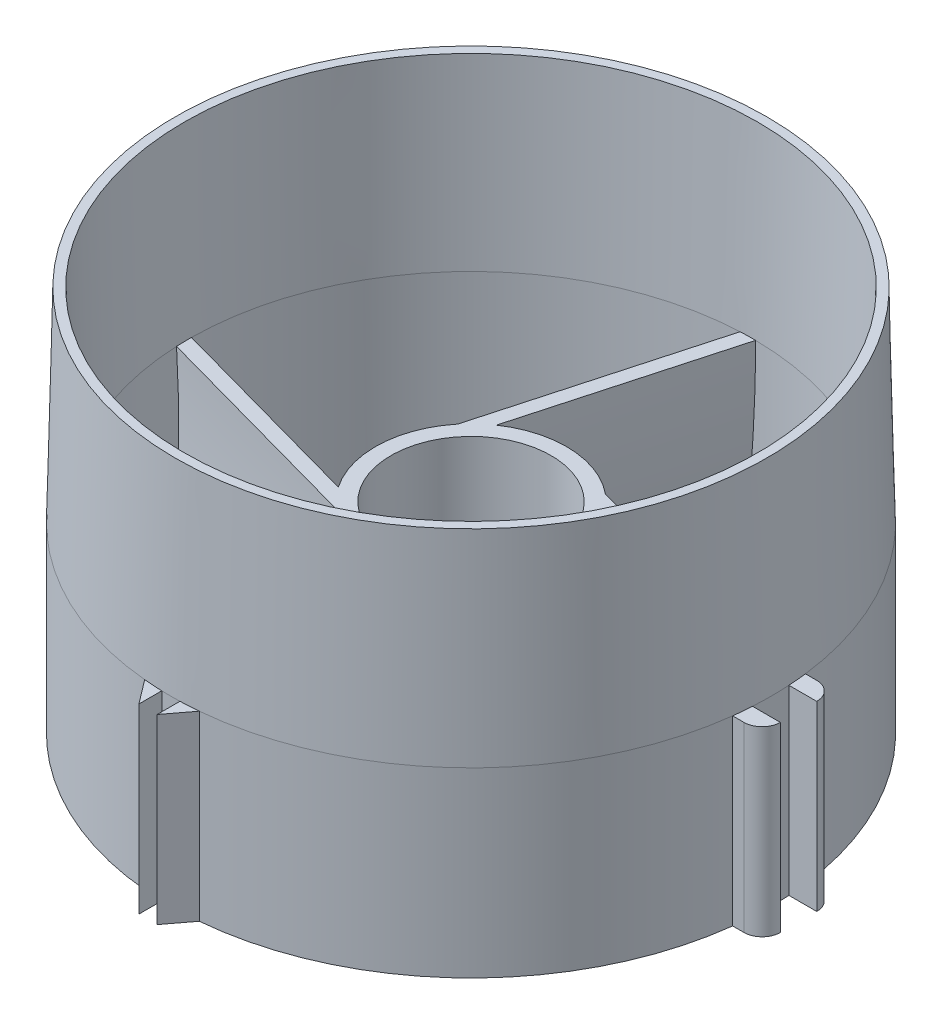
from build123d import *

# Parameters (mm, degrees)
SKETCH2_W           = 2.532291702
SKETCH2_H           = 1
BOSS_EXTRUDE1_DEPTH = 10
FILLET1_R           = 1
BOSS_EXTRUDE2_START = 2
SKETCH3_R           = 5.25
SKETCH3_R_2         = 4.4
BOSS_EXTRUDE2_DEPTH = 9
BOSS_EXTRUDE3_START = -0.893384
BOSS_EXTRUDE3_DEPTH = 13.479999236
CIRPATTERN2_COUNT   = 4


with BuildPart() as part:
    # Sketch1 → Revolve1 (revolve)
    with BuildSketch(Plane.XY, mode=Mode.PRIVATE) as revolve1_sk:
        Polygon((15.5, 11), (15.5, 0), (16.5, 0), (16.5, 10), (16.25, 21.2), (15.75, 21.2), align=None)
    revolve(revolve1_sk.sketch.rotate(Axis((0, 0, 0), (0, 1, 0)), 90), axis=Axis((0, 0, 0), (0, 1, 0)))

    # Sketch2 → Boss-Extrude1 (add)
    with BuildSketch(Plane(origin=(0, 0, 0), x_dir=(1, 0, 0), z_dir=(0, 1, 0))):
        with Locations((16.733854149, -1.5)):
            Rectangle(SKETCH2_W, SKETCH2_H)
        with Locations((16.733854149, 1.5)):
            Rectangle(SKETCH2_W, SKETCH2_H)
        with Locations((-16.733854149, 1.5)):
            Rectangle(SKETCH2_W, SKETCH2_H)
        with Locations((-16.733854149, -1.5)):
            Rectangle(SKETCH2_W, SKETCH2_H)
        Polygon((0.5, -16.492422502), (0.5, -17.75), (1.5, -16.431676725), align=None)
        Polygon((-0.5, -17.75), (-1.5, -16.431676725), (-0.5, -16.492422502), align=None)
        Polygon((0.5, 17.75), (1.5, 16.431676725), (0.5, 16.492422502), align=None)
        Polygon((-0.5, 16.492422502), (-0.5, 17.75), (-1.5, 16.431676725), align=None)
    extrude(amount=BOSS_EXTRUDE1_DEPTH)

    # Fillet1
    fillet1_edges = [part.edges().sort_by_distance(p)[0] for p in [
        (-18, 5, -2),
        (-18, 5, 2),
        (18, 5, -2),
        (18, 5, 2),
    ]]
    fillet(fillet1_edges, radius=FILLET1_R - 0.0001)  # a hair under: the kernel refuses the full size


with BuildPart() as body_2:
    # Sketch3 → Boss-Extrude2 (new body)
    with BuildSketch(Plane(origin=(0, 0, 0), x_dir=(1, 0, 0), z_dir=(0, 1, 0)).offset(BOSS_EXTRUDE2_START)):
        with Locations(Location((0, 0, 0), (0, 0, 270))):
            Circle(SKETCH3_R)
        with Locations(Location((0, 0, 0), (0, 0, 270))):
            Circle(SKETCH3_R_2, mode=Mode.SUBTRACT)
    extrude(amount=BOSS_EXTRUDE2_DEPTH)


with BuildPart() as body_3:
    # Sketch5 → Boss-Extrude3 (new body)
    with BuildSketch(Plane(origin=(15.902515524, 0, 4.4), x_dir=(0.2666666666666668, 0, -0.9637888196533974), z_dir=(0.9637888196533975, 0, 0.2666666666666668)).offset(BOSS_EXTRUDE3_START)):
        with BuildLine():
            Line((4, 11), (4.8, 11))
            ThreePointArc((4.8, 11), (4.682488051, 7), (4.8, 3))
            Line((4.8, 3), (4.4, 3))
            ThreePointArc((4.4, 3), (4.100062422, 6.995003121), (4, 11))
        make_face()
    extrude(amount=-BOSS_EXTRUDE3_DEPTH)


with BuildPart() as cirpattern2_1:
    # CirPattern2: pattern copy
    add(body_3.part.rotate(Axis((0, 0, 0), (0, 1, 0)), 1 * 360 / CIRPATTERN2_COUNT))


with BuildPart() as cirpattern2_2:
    # CirPattern2: pattern copy
    add(body_3.part.rotate(Axis((0, 0, 0), (0, 1, 0)), 2 * 360 / CIRPATTERN2_COUNT))


with BuildPart() as cirpattern2_3:
    # CirPattern2: pattern copy
    add(body_3.part.rotate(Axis((0, 0, 0), (0, 1, 0)), 3 * 360 / CIRPATTERN2_COUNT))


with BuildPart() as part_1:
    add(part.part)

    # Combine1: union body 2, body 3, CirPattern2_1, CirPattern2_2, CirPattern2_3
    add(body_2.part)
    add(body_3.part)
    add(cirpattern2_1.part)
    add(cirpattern2_2.part)
    add(cirpattern2_3.part)


solid = part_1.part
